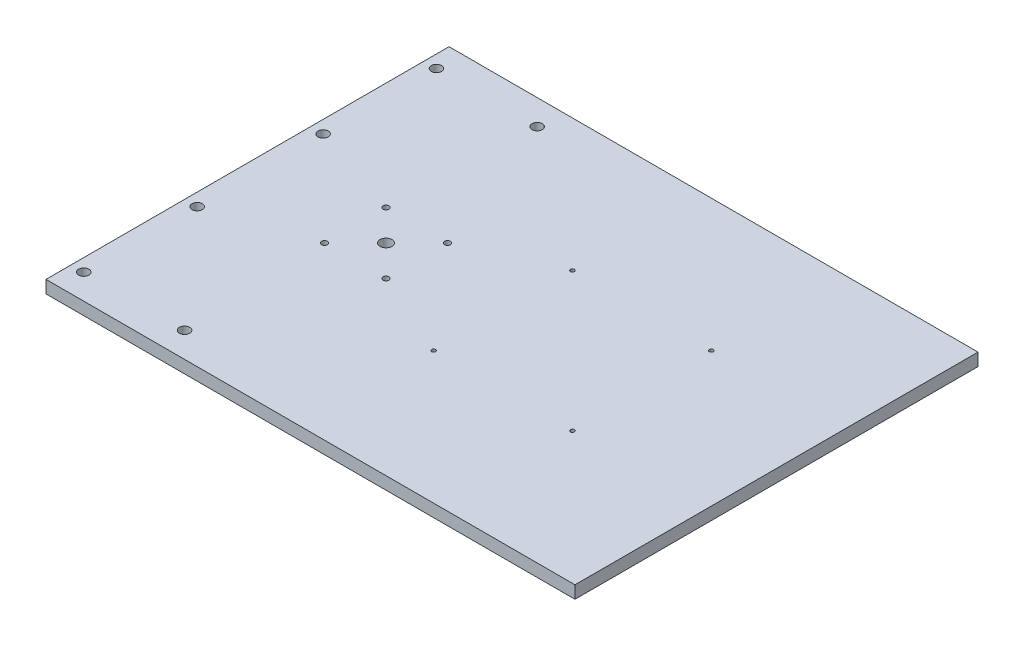
from build123d import *

# Parameters (mm, degrees)
SKETCH1_W           = 266.7
SKETCH1_H           = 203.2
BOSS_EXTRUDE1_DEPTH = 6.35
SKETCH3_R           = 2.600000007
CUT_EXTRUDE1_DEPTH  = 168.765029133
SKETCH5_R           = 1.5
SKETCH5_R_2         = 3.007999953
CUT_EXTRUDE2_DEPTH  = 168.765029133
SKETCH7_R           = 0.999998
CUT_EXTRUDE3_DEPTH  = 168.765029133


with BuildPart() as part:
    # Sketch1 → Boss-Extrude1 (new body)
    with BuildSketch(Plane(origin=(0, 0, 0), x_dir=(1, 0, 0), z_dir=(0, 1, 0))):
        Rectangle(SKETCH1_W, SKETCH1_H)
    extrude(amount=BOSS_EXTRUDE1_DEPTH)

    # Sketch3 → Cut-Extrude1 (cut, through all)
    with BuildSketch(Plane(origin=(0, 6.35, 0), x_dir=(1, 0, 0), z_dir=(0, 1, 0))):
        with Locations((-127, -31.75)):
            Circle(SKETCH3_R)
        with Locations((-76.2, -88.9)):
            Circle(SKETCH3_R)
        with Locations((-127, -88.9)):
            Circle(SKETCH3_R)
    cut_extrude1 = extrude(amount=-CUT_EXTRUDE1_DEPTH, mode=Mode.SUBTRACT)

    # Mirror1: Cut-Extrude1 across plane
    add(cut_extrude1.mirror(Plane.XY), mode=Mode.SUBTRACT)

    # Sketch5 → Cut-Extrude2 (cut, through all)
    with BuildSketch(Plane(origin=(0, 6.35, 0), x_dir=(1, 0, 0), z_dir=(0, 1, 0))):
        with Locations((-48.024, 15.5)):
            Circle(SKETCH5_R)
        with Locations((-48.024, -15.5)):
            Circle(SKETCH5_R)
        with Locations((-79.024, 15.5)):
            Circle(SKETCH5_R)
        with Locations((-79.024, -15.5)):
            Circle(SKETCH5_R)
        with Locations((-63.524, 0)):
            Circle(SKETCH5_R_2)
    extrude(amount=-CUT_EXTRUDE2_DEPTH, mode=Mode.SUBTRACT)

    # Sketch7 → Cut-Extrude3 (cut, through all)
    with BuildSketch(Plane(origin=(0, 6.35, 0), x_dir=(1, 0, 0), z_dir=(0, 1, 0))):
        with Locations((65.481787492, -35.001787527)):
            Circle(SKETCH7_R)
        with Locations((-4.521787522, -35.001787527)):
            Circle(SKETCH7_R)
        with Locations((-4.521787522, 35.001787488)):
            Circle(SKETCH7_R)
        with Locations((65.481787492, 35.001787488)):
            Circle(SKETCH7_R)
    extrude(amount=-CUT_EXTRUDE3_DEPTH, mode=Mode.SUBTRACT)


solid = part.part
